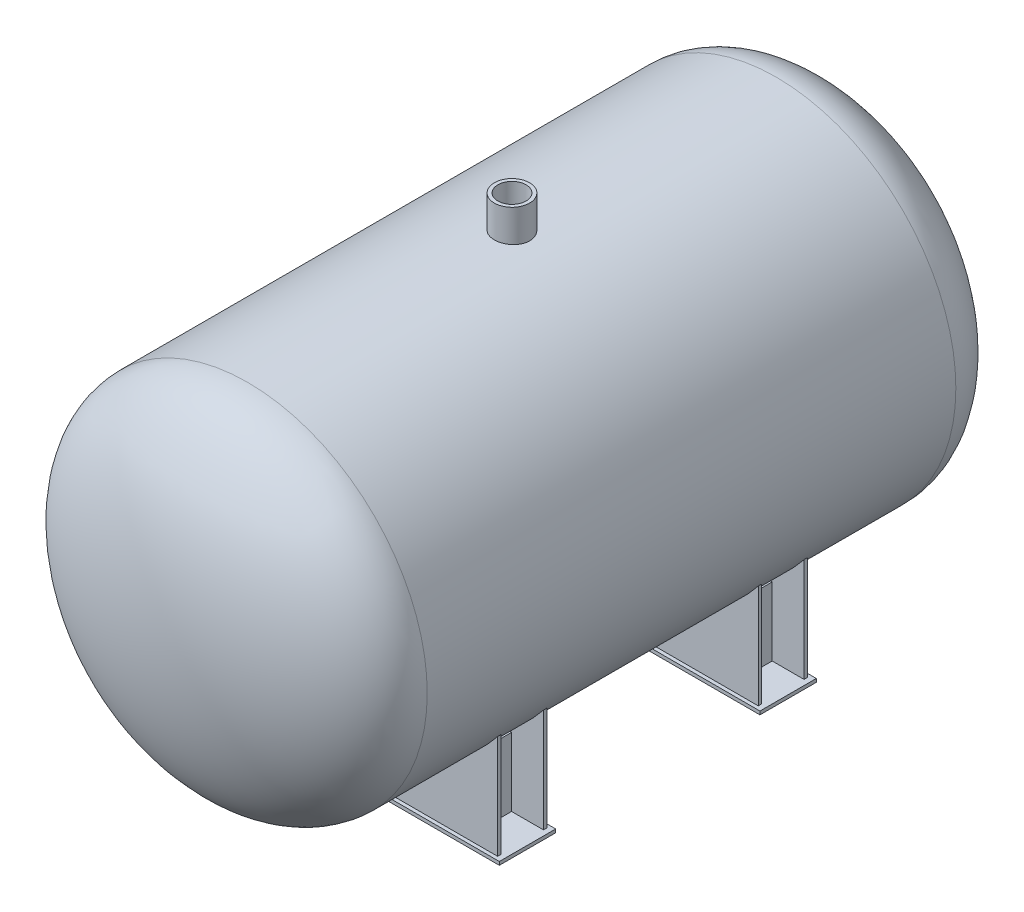
from build123d import *

# Parameters (mm, degrees)
REVOLVE_THIN6_OUTLINE_W  = 9.51
REVOLVE_THIN6_OUTLINE_H  = 1500
BOSS_EXTRUDE1_REACH      = 2196.358
BOSS_EXTRUDE1_END_RADIUS = 509.51
SKETCH2_R                = 50
SKETCH2_3_R              = 40
CUT_EXTRUDE1_DEPTH       = 681
EXTRUDE_THIN1_DEPTH      = 200
BOSS_EXTRUDE2_DEPTH      = 9.51
BOSS_EXTRUDE3_DEPTH      = 9.51
SKETCH6_W                = 120.49
SKETCH6_H                = 200
BOSS_EXTRUDE4_DEPTH      = 9.51
SKETCH7_W                = 120.49
SKETCH7_H                = 200
BOSS_EXTRUDE5_DEPTH      = 9.51
SKETCH9_W                = 830
SKETCH9_H                = 160
BOSS_EXTRUDE6_DEPTH      = 9.51


# Read off the part's stored shape, not the designer's step: Revolve-Thin6
with BuildPart() as part:
    # Revolve-Thin6 outline → Revolve-Thin6 (revolve)
    with BuildSketch(Plane.XZ):
        with BuildLine():
            Line((500, 1563.83732395), (509.51, 1563.83732395))
            add(Edge.make_bspline(
                [(509.51, 1563.83732395), (509.51, 1572.640982863), (508.643787837, 1581.444175539), (505.334918876, 1598.241930717), (503.019414824, 1606.246095111), (500, 1614.148268141)],
                knots=[0, 0, 0, 0, 0.0625, 0.0625, 0.120184222, 0.120184222, 0.120184222, 0.120184222], degree=3))
            Line((500, 1614.148268141), (500, 1563.83732395))
        make_face()
        with Locations((504.755, 813.83732395)):
            Rectangle(REVOLVE_THIN6_OUTLINE_W, REVOLVE_THIN6_OUTLINE_H)
        with BuildLine():
            Line((500, 1563.83732395), (500, 1614.148268141))
            add(Edge.make_bspline(
                [(500, 1614.148268141), (499.747923589, 1614.807982533), (499.490941078, 1615.466986068), (495.830407531, 1624.668358499), (491.608294938, 1633.08758507), (481.593340975, 1649.595024419), (475.800709404, 1657.683621858), (456.188152586, 1681.35807219), (440.131028126, 1696.351942266), (412.083284797, 1717.340149414), (402.074258631, 1724.08617844), (380.83217569, 1737.027954916), (369.599086165, 1743.223674694), (346.013697608, 1755.016368972), (333.661399293, 1760.613305622), (307.952296607, 1771.162763274), (294.595514249, 1776.115248691), (267.001643576, 1785.334066152), (252.764589993, 1789.600368567), (223.542992407, 1797.410003227), (208.558490668, 1800.953312176), (177.982254954, 1807.285857936), (162.39056778, 1810.075077186), (130.746315755, 1814.87466664), (114.693800491, 1816.885024311), (66.071436686, 1821.720819057), (33.036137497, 1823.34732395), (0, 1823.34732395)],
                knots=[0.120184222, 0.120184222, 0.120184222, 0.120184222, 0.125, 0.125, 0.1875, 0.1875, 0.25, 0.25, 0.375, 0.375, 0.4375, 0.4375, 0.5, 0.5, 0.5625, 0.5625, 0.625, 0.625, 0.6875, 0.6875, 0.75, 0.75, 0.8125, 0.8125, 0.875, 0.875, 1, 1, 1, 1], degree=3))
            Line((0, 1823.34732395), (0, 1813.83732395))
            add(Edge.make_bspline(
                [(500, 1563.83732395), (500, 1813.83732395), (0, 1813.83732395)],
                knots=[0, 0, 0, 1.570796327, 1.570796327, 1.570796327], degree=2, weights=[1, 0.707106781, 1]))
        make_face()
        with BuildLine():
            add(Edge.make_bspline(
                [(500, 13.526379759), (503.019414824, 21.428552789), (505.334918876, 29.432717183), (508.643787837, 46.230472361), (509.51, 55.033665037), (509.51, 63.83732395)],
                knots=[0.879815778, 0.879815778, 0.879815778, 0.879815778, 0.9375, 0.9375, 1, 1, 1, 1], degree=3))
            Line((509.51, 63.83732395), (500, 63.83732395))
            Line((500, 63.83732395), (500, 13.526379759))
        make_face()
        with BuildLine():
            add(Edge.make_bspline(
                [(0, -195.67267605), (33.036137497, -195.67267605), (66.071436686, -194.046171157), (114.693800491, -189.210376411), (130.746315755, -187.20001874), (162.39056778, -182.400429286), (177.982254954, -179.611210036), (208.558490668, -173.278664276), (223.542992407, -169.735355327), (252.764589993, -161.925720667), (267.001643576, -157.659418252), (294.595514249, -148.440600791), (307.952296607, -143.488115374), (333.661399293, -132.938657721), (346.013697608, -127.341721072), (369.599086165, -115.549026794), (380.83217569, -109.353307016), (402.074258631, -96.41153054), (412.083284797, -89.665501514), (440.131028126, -68.677294366), (456.188152586, -53.68342429), (475.800709404, -30.008973958), (481.593340975, -21.920376519), (491.608294938, -5.41293717), (495.830407531, 3.006289401), (499.490941078, 12.207661832), (499.747923589, 12.866665367), (500, 13.526379759)],
                knots=[0, 0, 0, 0, 0.125, 0.125, 0.1875, 0.1875, 0.25, 0.25, 0.3125, 0.3125, 0.375, 0.375, 0.4375, 0.4375, 0.5, 0.5, 0.5625, 0.5625, 0.625, 0.625, 0.75, 0.75, 0.8125, 0.8125, 0.875, 0.875, 0.879815778, 0.879815778, 0.879815778, 0.879815778], degree=3))
            Line((500, 13.526379759), (500, 63.83732395))
            add(Edge.make_bspline(
                [(0, -186.16267605), (500, -186.16267605), (500, 63.83732395)],
                knots=[4.71238898, 4.71238898, 4.71238898, 6.283185307, 6.283185307, 6.283185307], degree=2, weights=[1, 0.707106781, 1]))
            Line((0, -186.16267605), (0, -195.67267605))
        make_face()
    revolve(axis=Axis((0, 0, 0), (0, 0, 1)))

    # Boss-Extrude1: up to this cylinder (the profile starts outside it)
    boss_extrude1_end = Plane(origin=(0, 0, 813.837324), z_dir=(0, 0, 1)) * Cylinder(BOSS_EXTRUDE1_END_RADIUS, 5412.736, mode=Mode.PRIVATE)
    # Sketch2 → Boss-Extrude1 (add, up to the surface)
    with BuildSketch(Plane(origin=(0, 600, 0), x_dir=(1, 0, 0), z_dir=(0, 1, 0)), mode=Mode.PRIVATE) as boss_extrude1_sk1:
        with Locations(Location((0, -813.83732395, 0), (0, 0, 270))):
            Circle(SKETCH2_R)
    boss_extrude1_tool1 = extrude(boss_extrude1_sk1.sketch, amount=-BOSS_EXTRUDE1_REACH, mode=Mode.PRIVATE) - boss_extrude1_end
    add(boss_extrude1_tool1.solids().sort_by_distance((0, 600, 813.837324))[0])

    # Sketch2<3> → Cut-Extrude1 (cut)
    with BuildSketch(Plane(origin=(0, 600, 0), x_dir=(1, 0, 0), z_dir=(0, 1, 0))):
        with Locations(Location((0, -813.83732395, 0), (0, 0, 270))):
            Circle(SKETCH2_3_R)
    extrude(amount=-CUT_EXTRUDE1_DEPTH, mode=Mode.SUBTRACT)

    # Sketch3 → Extrude-Thin1 (add)
    with BuildSketch(Plane.XY.offset(350)):
        with BuildLine():
            ThreePointArc((-466.559163918, -193.255133344), (98.520612618, -495.296566604), (505, 0))
            Line((505, 0), (495, 0))
            ThreePointArc((495, 0), (96.569709398, -485.4887138), (-457.320368593, -189.428299021))
            Line((-457.320368593, -189.428299021), (-466.559163918, -193.255133344))
        make_face()
    extrude(amount=EXTRUDE_THIN1_DEPTH)

    # Sketch4 → Boss-Extrude2 (add)
    with BuildSketch(Plane.XY.offset(385)):
        with BuildLine():
            Line((-400, -315.595374016), (-400, -615.595374016))
            Line((-400, -615.595374016), (400, -615.595374016))
            Line((400, -615.595374016), (400, -315.595374016))
            ThreePointArc((400, -315.595374016), (0, -509.51), (-400, -315.595374016))
        make_face()
    boss_extrude2 = extrude(amount=-BOSS_EXTRUDE2_DEPTH)

    # Sketch5 → Boss-Extrude3 (add)
    with BuildSketch(Plane.XY.offset(515)):
        with BuildLine():
            Line((-400, -315.595374016), (-400, -615.595374016))
            Line((-400, -615.595374016), (400, -615.595374016))
            Line((400, -615.595374016), (400, -315.595374016))
            ThreePointArc((400, -315.595374016), (0, -509.51), (-400, -315.595374016))
        make_face()
    boss_extrude3 = extrude(amount=-BOSS_EXTRUDE3_DEPTH)

    # Sketch6 → Boss-Extrude4 (add)
    with BuildSketch(Plane(origin=(300, 0, 0), x_dir=(0, 0, -1), z_dir=(1, 0, 0))):
        with Locations((-445.245, -515.595374016)):
            Rectangle(SKETCH6_W, SKETCH6_H)
    boss_extrude4 = extrude(amount=BOSS_EXTRUDE4_DEPTH)

    # Sketch7 → Boss-Extrude5 (add)
    with BuildSketch(Plane(origin=(-300, 0, 0), x_dir=(0, 0, -1), z_dir=(1, 0, 0))):
        with Locations((-445.245, -515.595374016)):
            Rectangle(SKETCH7_W, SKETCH7_H)
    boss_extrude5 = extrude(amount=-BOSS_EXTRUDE5_DEPTH)

    # Sketch9 → Boss-Extrude6 (add)
    with BuildSketch(Plane(origin=(0, -610, 0), x_dir=(1, 0, 0), z_dir=(0, 1, 0))):
        with Locations((0, -445.245)):
            Rectangle(SKETCH9_W, SKETCH9_H)
    boss_extrude6 = extrude(amount=-BOSS_EXTRUDE6_DEPTH)

    # Mirror2: Boss-Extrude2, Boss-Extrude3, Boss-Extrude4, Boss-Extrude5, Boss-Extrude6 across plane
    add(boss_extrude2.mirror(Plane.XY.offset(815)))
    add(boss_extrude3.mirror(Plane.XY.offset(815)))
    add(boss_extrude4.mirror(Plane.XY.offset(815)))
    add(boss_extrude5.mirror(Plane.XY.offset(815)))
    add(boss_extrude6.mirror(Plane.XY.offset(815)))


solid = part.part
